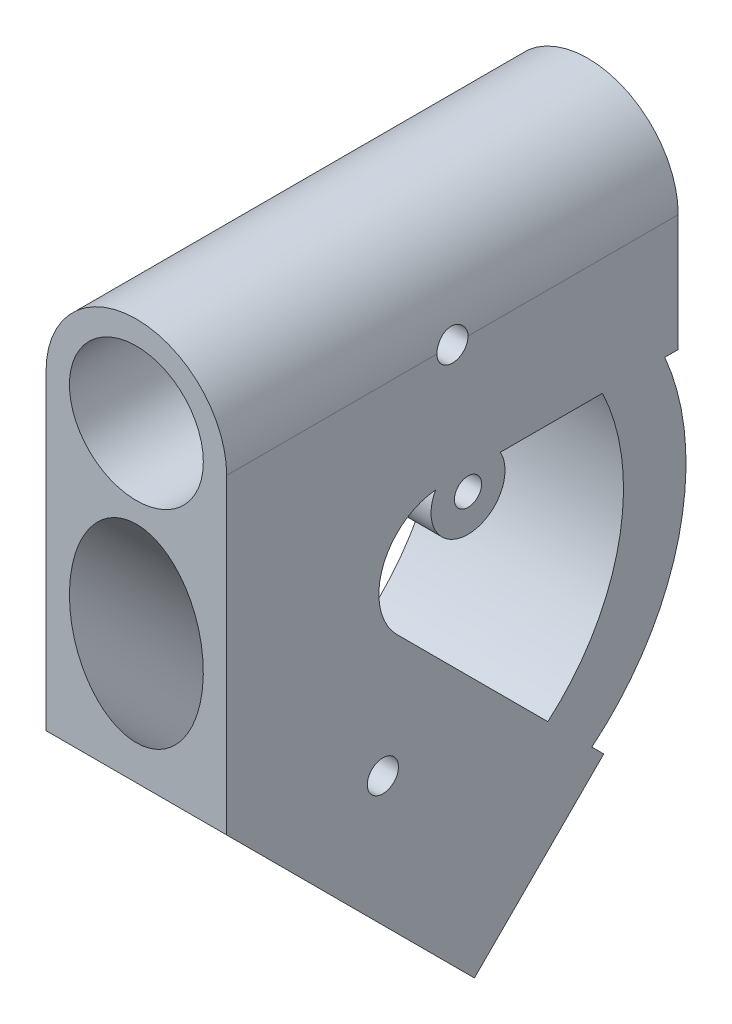
from build123d import *

# Parameters (mm, degrees)
CROQUIS1_R              = 8.6
SALIENTE_EXTRUIR1_DEPTH = 29
SALIENTE_EXTRUIR2_DEPTH = 11.6
CROQUIS4_R              = 8.6
CORTAR_EXTRUIR1_DEPTH   = 80
SALIENTE_EXTRUIR3_DEPTH = 11.6
CROQUIS8_R              = 4.75
CROQUIS8_R_2            = 1.75
SALIENTE_EXTRUIR4_DEPTH = 11.6
CROQUIS9_R              = 1.6
CORTAR_EXTRUIR2_DEPTH   = 10.5
CROQUIS10_R             = 2
CORTAR_EXTRUIR3_DEPTH   = 20


with BuildPart() as part:
    # Croquis1 → Saliente-Extruir1 (new, symmetric)
    with BuildSketch(Plane.XY):
        with BuildLine():
            Line((-11.6, -15), (11.6, -15))
            Line((11.6, -15), (11.6, 0))
            ThreePointArc((11.6, 0), (0, 11.6), (-11.6, 0))
            Line((-11.6, 0), (-11.6, -15))
        make_face()
        Circle(CROQUIS1_R, mode=Mode.SUBTRACT)
    extrude(amount=SALIENTE_EXTRUIR1_DEPTH, both=True)

    # Croquis2 → Saliente-Extruir2 (add, symmetric)
    with BuildSketch(Plane(origin=(0, 0, 0), x_dir=(0, 0, -1), z_dir=(1, 0, 0))):
        with BuildLine():
            Line((-29, -15), (-29, -40))
            Line((-29, -40), (2.819805153, -71.819805153))
            Line((2.819805153, -71.819805153), (19.436814511, -55.202795796))
            Line((19.436814511, -55.202795796), (-7.109127035, -28.656854249))
            ThreePointArc((-7.109127035, -28.656854249), (-8.843309045, -19.938532541), (-1.452272785, -15))
            Line((-1.452272785, -15), (-29, -15))
        make_face()
    extrude(amount=SALIENTE_EXTRUIR2_DEPTH, both=True)

    # Croquis4 → Cortar-Extruir1 (cut)
    with BuildSketch(Plane(origin=(0, -37.319805153, -37.319805153), x_dir=(-1, 0, 0), z_dir=(0, -0.7071067811865459, -0.7071067811865492))):
        with Locations((0, -37.040367902)):
            Circle(CROQUIS4_R)
    extrude(amount=-CORTAR_EXTRUIR1_DEPTH, mode=Mode.SUBTRACT)

    # Croquis7 → Saliente-Extruir3 (add, symmetric)
    with BuildSketch(Plane(origin=(0, 0, 0), x_dir=(0, 0, -1), z_dir=(1, 0, 0))):
        with BuildLine():
            Line((19.27018783, -15), (27.27018783, -15))
            ThreePointArc((27.27018783, -15), (29.073531932, -35.90670576), (17.9077889, -53.673770184))
            Line((17.9077889, -53.673770184), (12.25093465, -48.016915935))
            ThreePointArc((12.25093465, -48.016915935), (21.365831267, -32.700114073), (19.27018783, -15))
        make_face()
    extrude(amount=SALIENTE_EXTRUIR3_DEPTH, both=True)

    # Croquis8 → Saliente-Extruir4 (add, symmetric)
    with BuildSketch(Plane(origin=(0, 0, 0), x_dir=(0, 0, -1), z_dir=(1, 0, 0))):
        with Locations((2, -17.311351178)):
            Circle(CROQUIS8_R)
        with Locations((2, -17.311351178)):
            Circle(CROQUIS8_R_2, mode=Mode.SUBTRACT)
    extrude(amount=SALIENTE_EXTRUIR4_DEPTH, both=True)

    # Croquis9 → Cortar-Extruir2 (cut, symmetric)
    with BuildSketch(Plane(origin=(0, 0, 0), x_dir=(0, 0, -1), z_dir=(1, 0, 0))):
        with Locations((24.550935782, -21.731271468)):
            Circle(CROQUIS9_R)
        with Locations((20.109439567, -44.298351726)):
            Circle(CROQUIS9_R)
    extrude(amount=CORTAR_EXTRUIR2_DEPTH, both=True, mode=Mode.SUBTRACT)

    # Croquis10 → Cortar-Extruir3 (cut, symmetric)
    with BuildSketch(Plane(origin=(0, 0, 0), x_dir=(0, 0, -1), z_dir=(1, 0, 0))):
        Circle(CROQUIS10_R)
        with Locations((-8.935845084, -43.447145558)):
            Circle(CROQUIS10_R)
    extrude(amount=CORTAR_EXTRUIR3_DEPTH, both=True, mode=Mode.SUBTRACT)


solid = part.part
